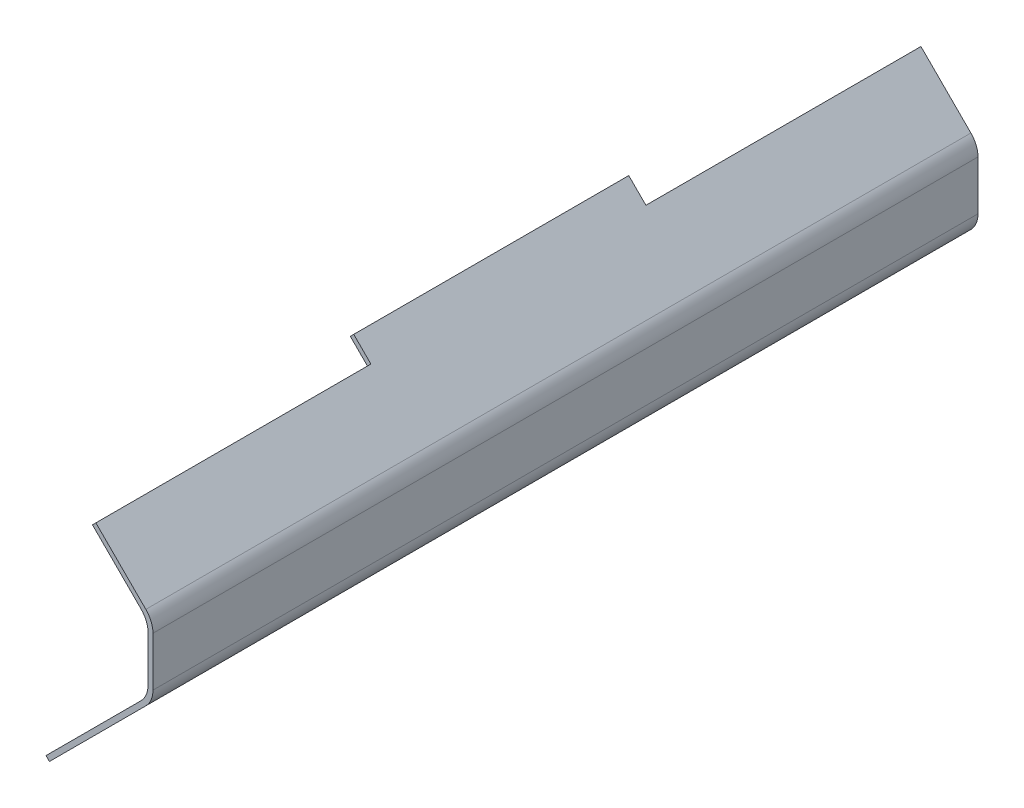
from build123d import *

# Parameters (mm, degrees)
BOSS_EXTRUDE1_DEPTH = 340
SKETCH4_W           = 113.333333333
SKETCH4_H           = 10
CUT_EXTRUDE3_DEPTH  = 357.904112914
SKETCH5_W           = 113.333333334
SKETCH5_H           = 10
CUT_EXTRUDE4_DEPTH  = 354.612513246
FILLET2_R           = 10


with BuildPart() as part:
    # Sketch1 → Boss-Extrude1 (new body)
    with BuildSketch(Plane.XY):
        Polygon((48.461940777, 43.461940777), (49.876154339, 44.876154339), (80.461940777, 14.290367902), (80.461940777, -14.290367902), (37.805086528, -56.947222151), (36.390872965, -55.533008589), (78.461940777, -13.461940777), (78.461940777, 13.461940777), align=None)
    extrude(amount=BOSS_EXTRUDE1_DEPTH)

    # Sketch4 → Cut-Extrude3 (cut, through all)
    with BuildSketch(Plane(origin=(45.961940777, 45.961940777, 0), x_dir=(0, 0, 1), z_dir=(-0.7071067811865477, -0.7071067811865475, 0))):
        with Locations((56.666666667, -8.535533906)):
            Rectangle(SKETCH4_W, SKETCH4_H)
        with Locations((283.333333334, -8.535533906)):
            Rectangle(SKETCH4_W, SKETCH4_H)
    extrude(amount=-CUT_EXTRUDE3_DEPTH, mode=Mode.SUBTRACT)

    # Sketch5 → Cut-Extrude4 (cut, through all)
    with BuildSketch(Plane(origin=(45.961940777, -45.961940777, 0), x_dir=(0, 0, 1), z_dir=(-0.7071067811865477, 0.7071067811865475, 0))):
        with Locations((170, -8.535533906)):
            Rectangle(SKETCH5_W, SKETCH5_H)
    extrude(amount=-CUT_EXTRUDE4_DEPTH, mode=Mode.SUBTRACT)

    # Fillet2
    fillet2_edges = [part.edges().sort_by_distance(p)[0] for p in [
        (80.461940777, 14.290367902, 170),
        (80.461940777, -14.290367902, 170),
        (78.461940777, -13.461940777, 170),
        (78.461940777, 13.461940777, 170),
    ]]
    fillet(fillet2_edges, radius=FILLET2_R)


solid = part.part
